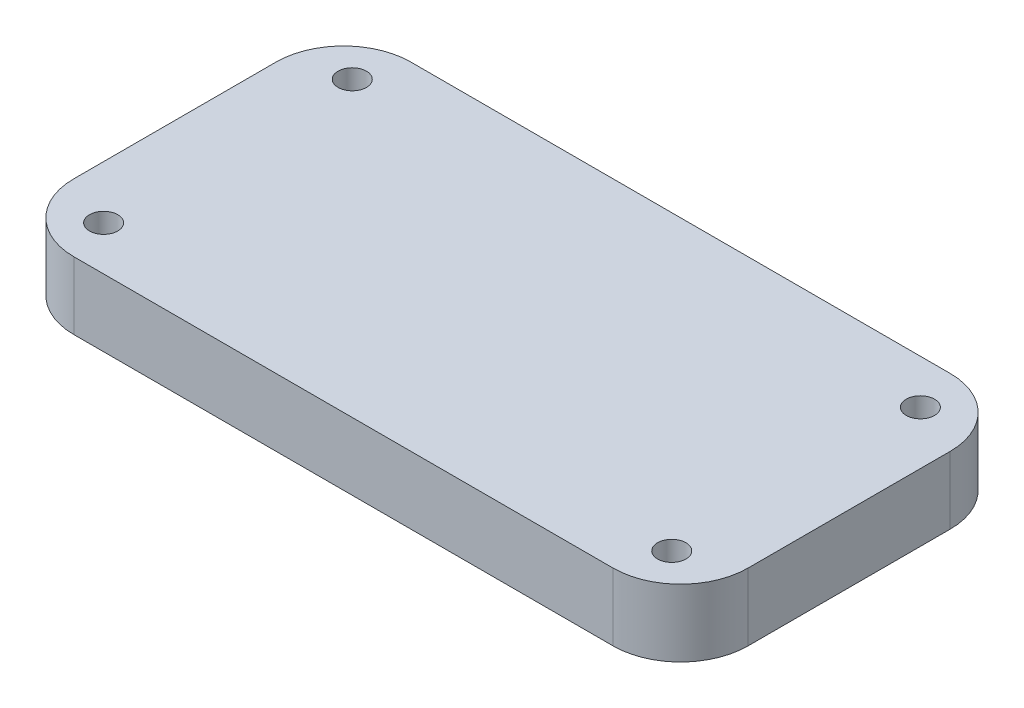
from build123d import *

# Parameters (mm, degrees)
SKETCH1_W           = 100
SKETCH1_H           = 50
BOSS_EXTRUDE1_DEPTH = 10
FILLET1_R           = 10
SKETCH2_R           = 2.1
CUT_EXTRUDE1_DEPTH  = 10


with BuildPart() as part:
    # Sketch1 → Boss-Extrude1 (new body)
    with BuildSketch(Plane(origin=(0, 0, 0), x_dir=(1, 0, 0), z_dir=(0, 1, 0))):
        Rectangle(SKETCH1_W, SKETCH1_H)
    extrude(amount=BOSS_EXTRUDE1_DEPTH)

    # Fillet1
    fillet1_edges = [part.edges().sort_by_distance(p)[0] for p in [
        (-50, 5, -25),
        (50, 5, -25),
        (50, 5, 25),
        (-50, 5, 25),
    ]]
    fillet(fillet1_edges, radius=FILLET1_R)

    # Sketch2 → Cut-Extrude1 (cut)
    with BuildSketch(Plane(origin=(0, 10, 0), x_dir=(1, 0, 0), z_dir=(0, 1, 0))):
        with Locations((-42.132384366, 18.438889303)):
            Circle(SKETCH2_R)
        with Locations((42.132384366, 18.438889303)):
            Circle(SKETCH2_R)
        with Locations((42.132384366, -18.438889303)):
            Circle(SKETCH2_R)
        with Locations((-42.132384366, -18.438889303)):
            Circle(SKETCH2_R)
    extrude(amount=-CUT_EXTRUDE1_DEPTH, mode=Mode.SUBTRACT)


solid = part.part
